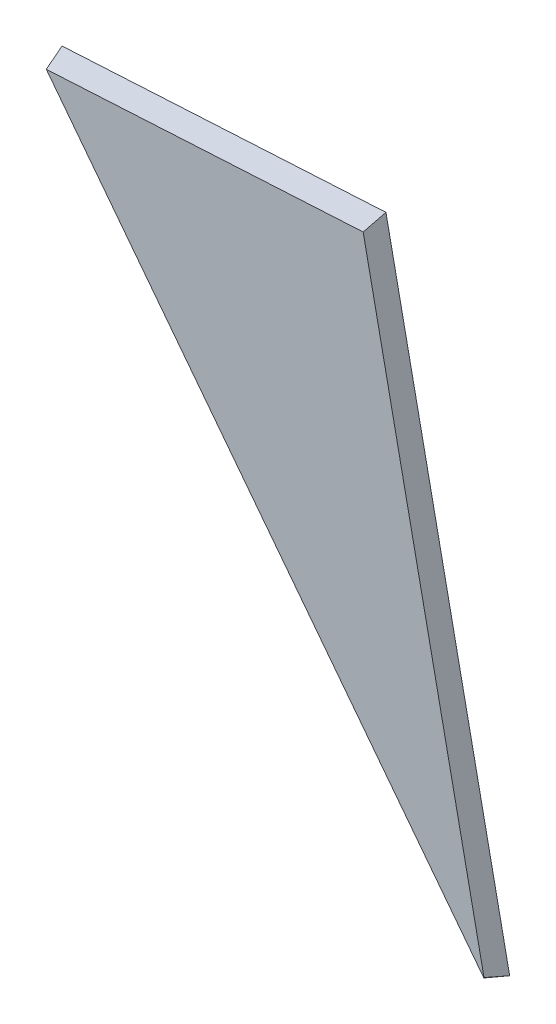
from build123d import *

# Parameters (mm, degrees)
EXTRUDE_1_DEPTH    = 60
CHAMFER3_SIZE2     = 11.912970931
CHAMFER3_SIZE      = 60
CHAMFER4_SIZE2     = 11.912970931
CHAMFER4_SIZE      = 60
CHAMFER5_SIZE2     = 9.519169095
CHAMFER5_SIZE      = 60
CUT_EXTRUDE1_DEPTH = 1279.275631979


with BuildPart() as part:
    # Эскиз1 → Бобышка-Вытянуть1 (new body)
    with BuildSketch(Plane.XY):
        Polygon((-849.589927609, 515.838957491), (787.506047005, 606.405063543), (281.615569427, -953.197537878), align=None)
    extrude(amount=EXTRUDE_1_DEPTH)

    # Chamfer3
    chamfer3_edges = [part.edges().sort_by_distance(p)[0] for p in [
        (-31.041940302, 561.122010517, 60),
    ]]
    chamfer3_side = [part.faces().sort_by_distance(p)[0] for p in [
        (-31.041940302, 561.122010517, 59.761740581),
    ]]
    chamfer(chamfer3_edges, length=CHAMFER3_SIZE - 0.0001, length2=CHAMFER3_SIZE2 - 0.0001, reference=chamfer3_side[0])  # a hair under: the kernel refuses the full size

    # Chamfer4
    chamfer4_edges = [part.edges().sort_by_distance(p)[0] for p in [
        (532.590398399, -179.470785737, 60),
    ]]
    chamfer4_side = [part.faces().sort_by_distance(p)[0] for p in [
        (532.590398399, -179.470785737, 59.761740581),
    ]]
    chamfer(chamfer4_edges, length=CHAMFER4_SIZE - 0.0001, length2=CHAMFER4_SIZE2 - 0.0001, reference=chamfer4_side[0])  # a hair under: the kernel refuses the full size

    # Chamfer5
    chamfer5_edges = [part.edges().sort_by_distance(p)[0] for p in [
        (-283.987179091, -218.679290193, 60),
    ]]
    chamfer5_side = [part.faces().sort_by_distance(p)[0] for p in [
        (-283.987179091, -218.679290193, 59.809616618),
    ]]
    chamfer(chamfer5_edges, length=CHAMFER5_SIZE - 0.0001, length2=CHAMFER5_SIZE2 - 0.0001, reference=chamfer5_side[0])  # a hair under: the kernel refuses the full size

    # Sketch1 → Cut-Extrude1 (cut, through all)
    with BuildSketch(Plane(origin=(0, 0, 0), x_dir=(-1, 0, 0), z_dir=(0, 0, -1))):
        Polygon((31.041940302, 561.122010517), (-281.615569427, -953.197537878), (-787.506047005, 606.405063543), align=None)
    extrude(amount=-CUT_EXTRUDE1_DEPTH, mode=Mode.SUBTRACT)


solid = part.part
